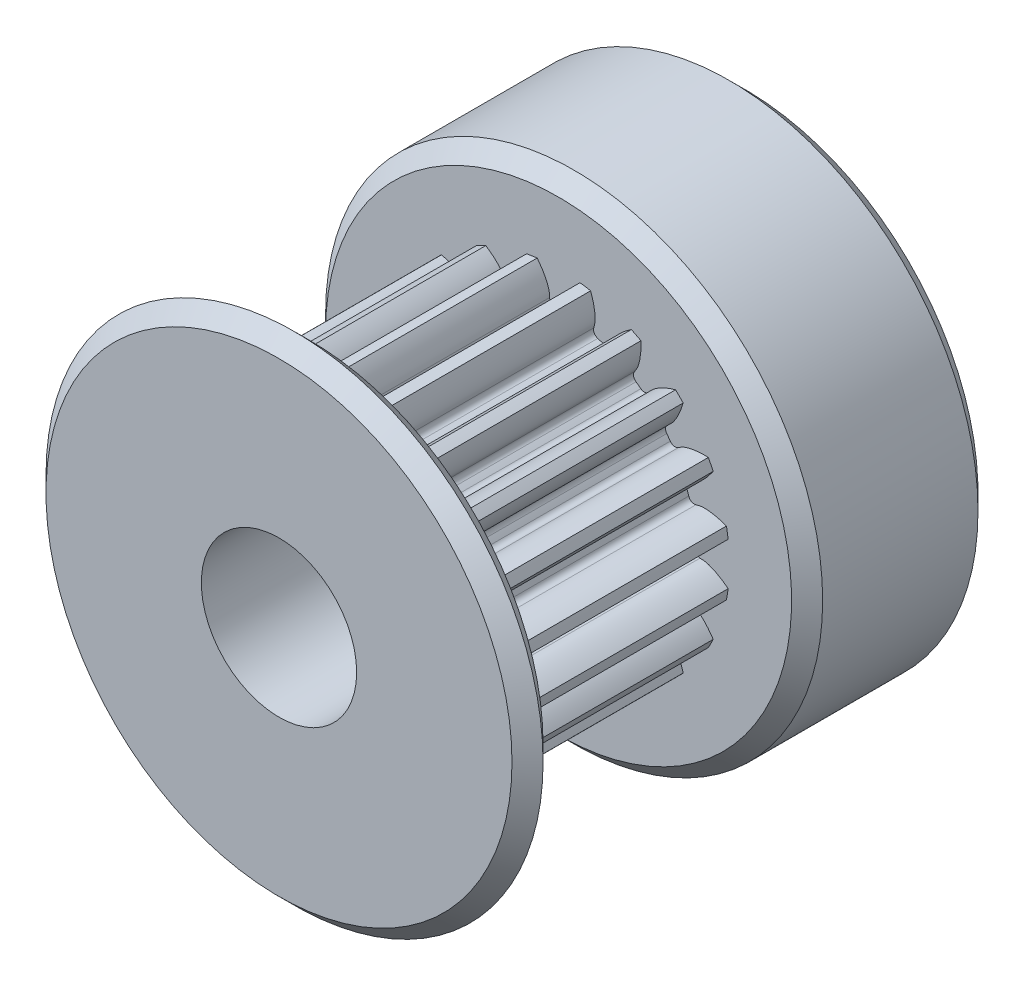
from build123d import *

# Parameters (mm, degrees)
SKETCH_1_R               = 5.5
LASHENA_DEPTH            = 8
CUT_EXTRUDEA_DEPTH       = 8
PATTERN_CIRCULAR_1_COUNT = 20
SKETCH_3_R               = 8
EXTRUDE_2_DEPTH          = 1
EXTRUDE_START            = 6
SKETCH_4_R               = 8
EXTRUDE_3_DEPTH          = 6
CHAMFER_1_SIZE           = 0.5
SKETCH_5_R               = 2.5
CUT_EXTRUDE_2_DEPTH      = 16


with BuildPart() as part:
    # 草图1 → LaShenA (new body)
    with BuildSketch(Plane.XY):
        Circle(SKETCH_1_R)
    extrude(amount=LASHENA_DEPTH)

    # SketchA → Cut-ExtrudeA (cut)
    with BuildSketch(Plane.XY.offset(8)):
        with BuildLine():
            ThreePointArc((0.096333474, 4.373939284), (0, 4.375), (-0.096333474, 4.373939284))
            ThreePointArc((-0.096333474, 4.373939284), (-0.229140321, 4.424050211), (-0.290157725, 4.552212763))
            add(Edge.make_bspline(
                [(-0.290157725, 4.552212763), (-0.292982519, 4.598075336), (-0.294060313, 4.658145107), (-0.304014503, 4.724212241), (-0.310185924, 4.752129248), (-0.315629723, 4.77423201), (-0.322624857, 4.799548846), (-0.331322283, 4.828017157), (-0.341907625, 4.859557712), (-0.354551332, 4.894087042), (-0.369424477, 4.931513561), (-0.386693401, 4.971738946), (-0.406521044, 5.014657874), (-0.429066204, 5.060158271), (-0.454483438, 5.108121423), (-0.482922771, 5.158422139), (-0.514529478, 5.210928903), (-0.549443843, 5.265504049), (-0.587800934, 5.322003932), (-0.629730381, 5.380279116), (-0.675356176, 5.44017456), (-0.724796396, 5.501529824), (-0.797466189, 5.586839692), (-0.855800311, 5.649793348), (-0.896573685, 5.69154901)],
                knots=[0.125068197, 0.125068197, 0.125068197, 0.125068197, 0.215847125, 0.244833276, 0.257593391, 0.272673526, 0.290073681, 0.309793857, 0.331834054, 0.356194271, 0.382874509, 0.411874767, 0.443195046, 0.476835345, 0.512795666, 0.551076006, 0.591676368, 0.634596749, 0.679837152, 0.727397575, 0.777278019, 0.829478483, 0.883998968, 1, 1, 1, 1], degree=3))
            ThreePointArc((-0.896573685, 5.69154901), (0, 5.761733638), (0.896573685, 5.69154901))
            add(Edge.make_bspline(
                [(0.290157725, 4.552212763), (0.292982519, 4.598075336), (0.294060313, 4.658145107), (0.304014503, 4.724212241), (0.310185924, 4.752129248), (0.315629723, 4.77423201), (0.322624857, 4.799548846), (0.331322283, 4.828017157), (0.341907625, 4.859557712), (0.354551332, 4.894087042), (0.369424477, 4.931513561), (0.386693401, 4.971738946), (0.406521044, 5.014657874), (0.429066204, 5.060158271), (0.454483438, 5.108121423), (0.482922771, 5.158422139), (0.514529478, 5.210928903), (0.549443843, 5.265504049), (0.587800934, 5.322003932), (0.629730381, 5.380279116), (0.675356176, 5.44017456), (0.724796396, 5.501529824), (0.797466189, 5.586839692), (0.855800311, 5.649793348), (0.896573685, 5.69154901)],
                knots=[0.125068197, 0.125068197, 0.125068197, 0.125068197, 0.215847125, 0.244833276, 0.257593391, 0.272673526, 0.290073681, 0.309793857, 0.331834054, 0.356194271, 0.382874509, 0.411874767, 0.443195046, 0.476835345, 0.512795666, 0.551076006, 0.591676368, 0.634596749, 0.679837152, 0.727397575, 0.777278019, 0.829478483, 0.883998968, 1, 1, 1, 1], degree=3))
            ThreePointArc((0.290157725, 4.552212763), (0.229140321, 4.424050211), (0.096333474, 4.373939284))
        make_face()
    cut_extrudea = extrude(amount=-CUT_EXTRUDEA_DEPTH, mode=Mode.SUBTRACT)

    # 阵列(圆周)1: Cut-ExtrudeA ×20 about axis
    pattern_circular_1_axis = Axis((0, 0, -88.99), (0, 0, 1))
    for i in range(1, PATTERN_CIRCULAR_1_COUNT):
        add(cut_extrudea.rotate(pattern_circular_1_axis, i * 360 / PATTERN_CIRCULAR_1_COUNT), mode=Mode.SUBTRACT)

    # 草图3 → 凸台-拉伸2 (add)
    with BuildSketch(Plane.XY.offset(8)):
        Circle(SKETCH_3_R)
    extrude(amount=EXTRUDE_2_DEPTH)

    # 草图4 → 凸台-拉伸3 (add)
    with BuildSketch(Plane(origin=(0, 0, 0), x_dir=(-1, 0, 0), z_dir=(0, 0, -1)).offset(EXTRUDE_START)):
        with Locations(Location((0, 0, 0), (0, 0, 180))):
            Circle(SKETCH_4_R)
    extrude(amount=-EXTRUDE_3_DEPTH)

    # 倒角1
    chamfer_1_edges = [part.edges().sort_by_distance(p)[0] for p in [
        (-8, 0, 8),
        (-8, 0, 9),
        (-8, 0, 0),
        (-8, 0, -6),
    ]]
    chamfer(chamfer_1_edges, length=CHAMFER_1_SIZE - 0.0001)  # a hair under: the kernel refuses the full size

    # 草图5 → 切除-拉伸2 (cut)
    with BuildSketch(Plane.XY.offset(9)):
        Circle(SKETCH_5_R)
    extrude(amount=-CUT_EXTRUDE_2_DEPTH, mode=Mode.SUBTRACT)


solid = part.part
